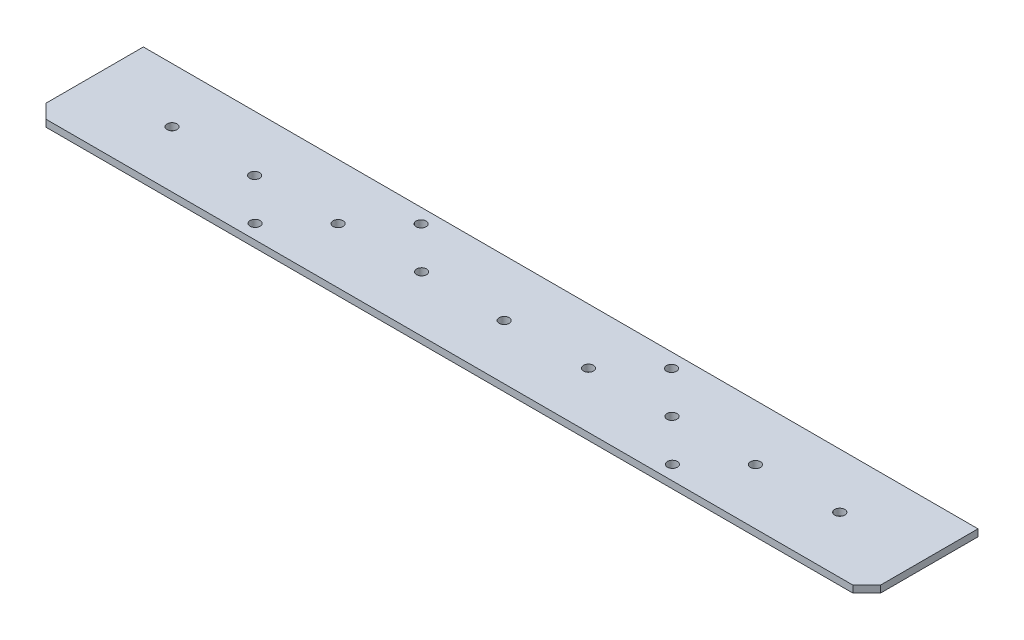
from build123d import *

# Parameters (mm, degrees)
SKETCH2_W           = 381
SKETCH2_H           = 50.8
BOSS_EXTRUDE1_DEPTH = 3.175
CUT_EXTRUDE1_REACH  = 386.385
SKETCH3_R           = 2.286


with BuildPart() as part:
    # Sketch2 → Boss-Extrude1 (new body)
    with BuildSketch(Plane(origin=(0, 0, 0), x_dir=(1, 0, 0), z_dir=(0, 1, 0))):
        with Locations((190.5, 25.4)):
            Rectangle(SKETCH2_W, SKETCH2_H)
    extrude(amount=BOSS_EXTRUDE1_DEPTH)

    # Sketch3 → Cut-Extrude1 (cut, up to next)
    with BuildSketch(Plane(origin=(0, 3.175, 0), x_dir=(1, 0, 0), z_dir=(0, 1, 0)), mode=Mode.PRIVATE) as cut_extrude1_sk1:
        with Locations((190.5, 25.003125)):
            Circle(SKETCH3_R)
    cut_extrude1_tool1 = extrude(cut_extrude1_sk1.sketch, amount=-CUT_EXTRUDE1_REACH, mode=Mode.PRIVATE) & part.part
    # Sketch3 → Cut-Extrude1 (cut, up to next)
    with BuildSketch(Plane(origin=(0, 3.175, 0), x_dir=(1, 0, 0), z_dir=(0, 1, 0)), mode=Mode.PRIVATE) as cut_extrude1_sk2:
        with Locations((38.1, 25.796875)):
            Circle(SKETCH3_R)
    cut_extrude1_tool2 = extrude(cut_extrude1_sk2.sketch, amount=-CUT_EXTRUDE1_REACH, mode=Mode.PRIVATE) & part.part
    # Sketch3 → Cut-Extrude1 (cut, up to next)
    with BuildSketch(Plane(origin=(0, 3.175, 0), x_dir=(1, 0, 0), z_dir=(0, 1, 0)), mode=Mode.PRIVATE) as cut_extrude1_sk3:
        with Locations((114.3, 25.4)):
            Circle(SKETCH3_R)
    cut_extrude1_tool3 = extrude(cut_extrude1_sk3.sketch, amount=-CUT_EXTRUDE1_REACH, mode=Mode.PRIVATE) & part.part
    # Sketch3 → Cut-Extrude1 (cut, up to next)
    with BuildSketch(Plane(origin=(0, 3.175, 0), x_dir=(1, 0, 0), z_dir=(0, 1, 0)), mode=Mode.PRIVATE) as cut_extrude1_sk4:
        with Locations((76.2, 25.4)):
            Circle(SKETCH3_R)
    cut_extrude1_tool4 = extrude(cut_extrude1_sk4.sketch, amount=-CUT_EXTRUDE1_REACH, mode=Mode.PRIVATE) & part.part
    # Sketch3 → Cut-Extrude1 (cut, up to next)
    with BuildSketch(Plane(origin=(0, 3.175, 0), x_dir=(1, 0, 0), z_dir=(0, 1, 0)), mode=Mode.PRIVATE) as cut_extrude1_sk5:
        with Locations((152.4, 25.4)):
            Circle(SKETCH3_R)
    cut_extrude1_tool5 = extrude(cut_extrude1_sk5.sketch, amount=-CUT_EXTRUDE1_REACH, mode=Mode.PRIVATE) & part.part
    # Sketch3 → Cut-Extrude1 (cut, up to next)
    with BuildSketch(Plane(origin=(0, 3.175, 0), x_dir=(1, 0, 0), z_dir=(0, 1, 0)), mode=Mode.PRIVATE) as cut_extrude1_sk6:
        with Locations((228.6, 25.4)):
            Circle(SKETCH3_R)
    cut_extrude1_tool6 = extrude(cut_extrude1_sk6.sketch, amount=-CUT_EXTRUDE1_REACH, mode=Mode.PRIVATE) & part.part
    # Sketch3 → Cut-Extrude1 (cut, up to next)
    with BuildSketch(Plane(origin=(0, 3.175, 0), x_dir=(1, 0, 0), z_dir=(0, 1, 0)), mode=Mode.PRIVATE) as cut_extrude1_sk7:
        with Locations((304.8, 25.4)):
            Circle(SKETCH3_R)
    cut_extrude1_tool7 = extrude(cut_extrude1_sk7.sketch, amount=-CUT_EXTRUDE1_REACH, mode=Mode.PRIVATE) & part.part
    # Sketch3 → Cut-Extrude1 (cut, up to next)
    with BuildSketch(Plane(origin=(0, 3.175, 0), x_dir=(1, 0, 0), z_dir=(0, 1, 0)), mode=Mode.PRIVATE) as cut_extrude1_sk8:
        with Locations((266.7, 25.4)):
            Circle(SKETCH3_R)
    cut_extrude1_tool8 = extrude(cut_extrude1_sk8.sketch, amount=-CUT_EXTRUDE1_REACH, mode=Mode.PRIVATE) & part.part
    # Sketch3 → Cut-Extrude1 (cut, up to next)
    with BuildSketch(Plane(origin=(0, 3.175, 0), x_dir=(1, 0, 0), z_dir=(0, 1, 0)), mode=Mode.PRIVATE) as cut_extrude1_sk9:
        with Locations((342.9, 25.796875)):
            Circle(SKETCH3_R)
    cut_extrude1_tool9 = extrude(cut_extrude1_sk9.sketch, amount=-CUT_EXTRUDE1_REACH, mode=Mode.PRIVATE) & part.part
    # Sketch3 → Cut-Extrude1 (cut, up to next)
    with BuildSketch(Plane(origin=(0, 3.175, 0), x_dir=(1, 0, 0), z_dir=(0, 1, 0)), mode=Mode.PRIVATE) as cut_extrude1_sk10:
        with Locations((247.65, 44.252590674)):
            Circle(SKETCH3_R)
    cut_extrude1_tool10 = extrude(cut_extrude1_sk10.sketch, amount=-CUT_EXTRUDE1_REACH, mode=Mode.PRIVATE) & part.part
    # Sketch3 → Cut-Extrude1 (cut, up to next)
    with BuildSketch(Plane(origin=(0, 3.175, 0), x_dir=(1, 0, 0), z_dir=(0, 1, 0)), mode=Mode.PRIVATE) as cut_extrude1_sk11:
        with Locations((285.75, 6.547409326)):
            Circle(SKETCH3_R)
    cut_extrude1_tool11 = extrude(cut_extrude1_sk11.sketch, amount=-CUT_EXTRUDE1_REACH, mode=Mode.PRIVATE) & part.part
    # Sketch3 → Cut-Extrude1 (cut, up to next)
    with BuildSketch(Plane(origin=(0, 3.175, 0), x_dir=(1, 0, 0), z_dir=(0, 1, 0)), mode=Mode.PRIVATE) as cut_extrude1_sk12:
        with Locations((95.25, 6.547409326)):
            Circle(SKETCH3_R)
    cut_extrude1_tool12 = extrude(cut_extrude1_sk12.sketch, amount=-CUT_EXTRUDE1_REACH, mode=Mode.PRIVATE) & part.part
    # Sketch3 → Cut-Extrude1 (cut, up to next)
    with BuildSketch(Plane(origin=(0, 3.175, 0), x_dir=(1, 0, 0), z_dir=(0, 1, 0)), mode=Mode.PRIVATE) as cut_extrude1_sk13:
        with Locations((133.35, 44.252590674)):
            Circle(SKETCH3_R)
    cut_extrude1_tool13 = extrude(cut_extrude1_sk13.sketch, amount=-CUT_EXTRUDE1_REACH, mode=Mode.PRIVATE) & part.part
    # Sketch3 → Cut-Extrude1 (cut, up to next)
    with BuildSketch(Plane(origin=(0, 3.175, 0), x_dir=(1, 0, 0), z_dir=(0, 1, 0)), mode=Mode.PRIVATE) as cut_extrude1_sk14:
        Polygon((0, 6.35), (6.35, 0), (0, 0), align=None)
    cut_extrude1_tool14 = extrude(cut_extrude1_sk14.sketch, amount=-CUT_EXTRUDE1_REACH, mode=Mode.PRIVATE) & part.part
    # Sketch3 → Cut-Extrude1 (cut, up to next)
    with BuildSketch(Plane(origin=(0, 3.175, 0), x_dir=(1, 0, 0), z_dir=(0, 1, 0)), mode=Mode.PRIVATE) as cut_extrude1_sk15:
        Polygon((374.65, 0), (381, 0), (381, 6.35), align=None)
    cut_extrude1_tool15 = extrude(cut_extrude1_sk15.sketch, amount=-CUT_EXTRUDE1_REACH, mode=Mode.PRIVATE) & part.part
    add(cut_extrude1_tool1.solids().sort_by_distance((190.5, 3.175, -25.003125))[0], mode=Mode.SUBTRACT)
    add(cut_extrude1_tool2.solids().sort_by_distance((38.1, 3.175, -25.796875))[0], mode=Mode.SUBTRACT)
    add(cut_extrude1_tool3.solids().sort_by_distance((114.3, 3.175, -25.4))[0], mode=Mode.SUBTRACT)
    add(cut_extrude1_tool4.solids().sort_by_distance((76.2, 3.175, -25.4))[0], mode=Mode.SUBTRACT)
    add(cut_extrude1_tool5.solids().sort_by_distance((152.4, 3.175, -25.4))[0], mode=Mode.SUBTRACT)
    add(cut_extrude1_tool6.solids().sort_by_distance((228.6, 3.175, -25.4))[0], mode=Mode.SUBTRACT)
    add(cut_extrude1_tool7.solids().sort_by_distance((304.8, 3.175, -25.4))[0], mode=Mode.SUBTRACT)
    add(cut_extrude1_tool8.solids().sort_by_distance((266.7, 3.175, -25.4))[0], mode=Mode.SUBTRACT)
    add(cut_extrude1_tool9.solids().sort_by_distance((342.9, 3.175, -25.796875))[0], mode=Mode.SUBTRACT)
    add(cut_extrude1_tool10.solids().sort_by_distance((247.65, 3.175, -44.252591))[0], mode=Mode.SUBTRACT)
    add(cut_extrude1_tool11.solids().sort_by_distance((285.75, 3.175, -6.547409))[0], mode=Mode.SUBTRACT)
    add(cut_extrude1_tool12.solids().sort_by_distance((95.25, 3.175, -6.547409))[0], mode=Mode.SUBTRACT)
    add(cut_extrude1_tool13.solids().sort_by_distance((133.35, 3.175, -44.252591))[0], mode=Mode.SUBTRACT)
    add(cut_extrude1_tool14.solids().sort_by_distance((2.116667, 3.175, -2.116667))[0], mode=Mode.SUBTRACT)
    add(cut_extrude1_tool15.solids().sort_by_distance((378.883333, 3.175, -2.116667))[0], mode=Mode.SUBTRACT)


solid = part.part
